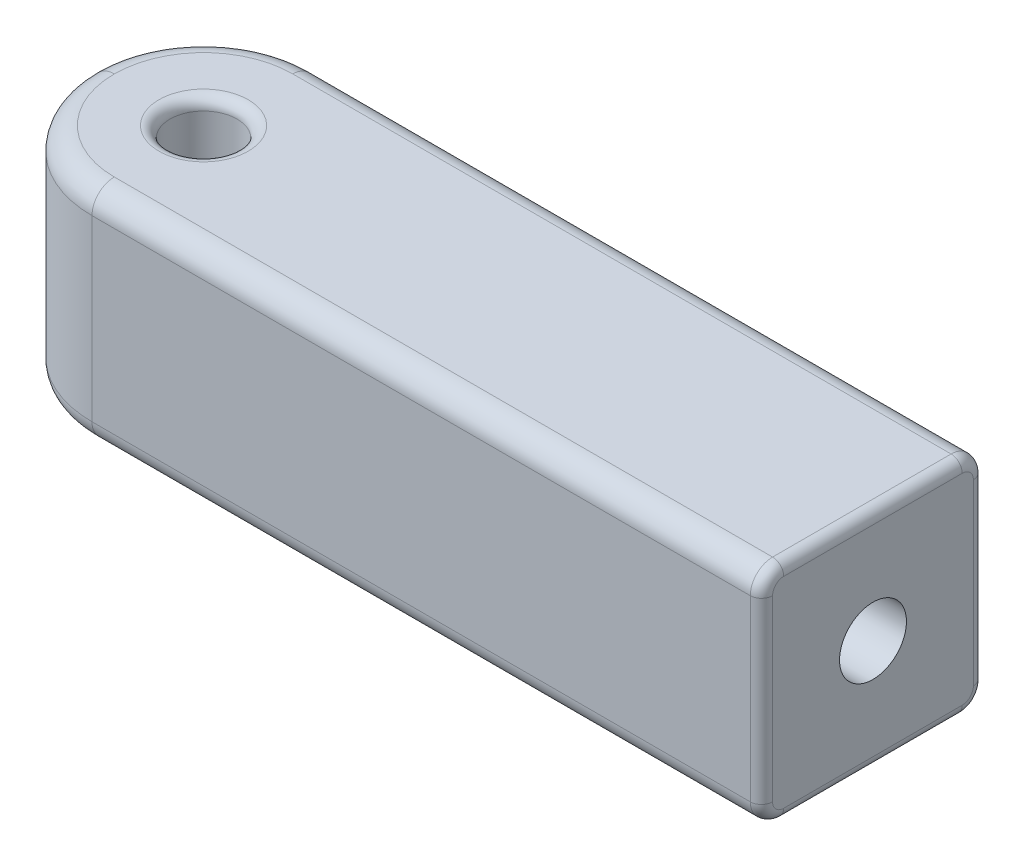
from build123d import *

# Parameters (mm, degrees)
CROQUIS1_W              = 175
CROQUIS1_H              = 50
SALIENTE_EXTRUIR1_DEPTH = 50
REDONDEO1_R             = 25
CROQUIS2_R              = 7.5
CORTAR_EXTRUIR1_DEPTH   = 15
CROQUIS3_R              = 7.5
CORTAR_EXTRUIR2_DEPTH   = 189.745860882
REDONDEO2_R             = 5
REDONDEO3_R             = 2.5
REDONDEO4_R             = 2.5


with BuildPart() as part:
    # Croquis1 → Saliente-Extruir1 (new body)
    with BuildSketch(Plane.XY):
        with Locations((87.5, 25)):
            Rectangle(CROQUIS1_W, CROQUIS1_H)
    extrude(amount=SALIENTE_EXTRUIR1_DEPTH)

    # Redondeo1
    redondeo1_edges = [part.edges().sort_by_distance(p)[0] for p in [
        (0, 25, 0),
        (0, 25, 50),
    ]]
    fillet(redondeo1_edges, radius=REDONDEO1_R - 0.0001)  # a hair under: the kernel refuses the full size

    # Croquis2 → Cortar-Extruir1 (cut)
    with BuildSketch(Plane(origin=(175, 0, 0), x_dir=(0, 0, -1), z_dir=(1, 0, 0))):
        with Locations((-25, 25)):
            Circle(CROQUIS2_R)
    extrude(amount=-CORTAR_EXTRUIR1_DEPTH, mode=Mode.SUBTRACT)

    # Croquis3 → Cortar-Extruir2 (cut, through all)
    with BuildSketch(Plane(origin=(0, 50, 0), x_dir=(1, 0, 0), z_dir=(0, 1, 0))):
        with Locations(Location((25, -25, 0), (0, 0, 270))):
            Circle(CROQUIS3_R)
    extrude(amount=-CORTAR_EXTRUIR2_DEPTH, mode=Mode.SUBTRACT)

    # Redondeo2
    redondeo2_edges = [part.edges().sort_by_distance(p)[0] for p in [
        (99.99995, 50, 50),
        (99.99995, 0, 0),
        (99.99995, 0, 50),
        (7.322301181, 0, 42.677698819),
        (7.322301181, 0, 7.322301181),
        (7.322301181, 50, 42.677698819),
        (7.322301181, 50, 7.322301181),
        (99.99995, 50, 0),
    ]]
    fillet(redondeo2_edges, radius=REDONDEO2_R)

    # Redondeo3
    redondeo3_edges = [part.edges().sort_by_distance(p)[0] for p in [
        (25, 0, 17.5),
        (25, 50, 17.5),
    ]]
    fillet(redondeo3_edges, radius=REDONDEO3_R)

    # Redondeo4
    redondeo4_edges = [part.edges().sort_by_distance(p)[0] for p in [
        (175, 0, 25),
        (175, 50, 25),
        (175, 25, 0),
        (175, 25, 50),
        (175, 48.535533906, 48.535533906),
        (175, 48.535533906, 1.464466094),
        (175, 1.464466094, 48.535533906),
        (175, 1.464466094, 1.464466094),
    ]]
    fillet(redondeo4_edges, radius=REDONDEO4_R)


solid = part.part
